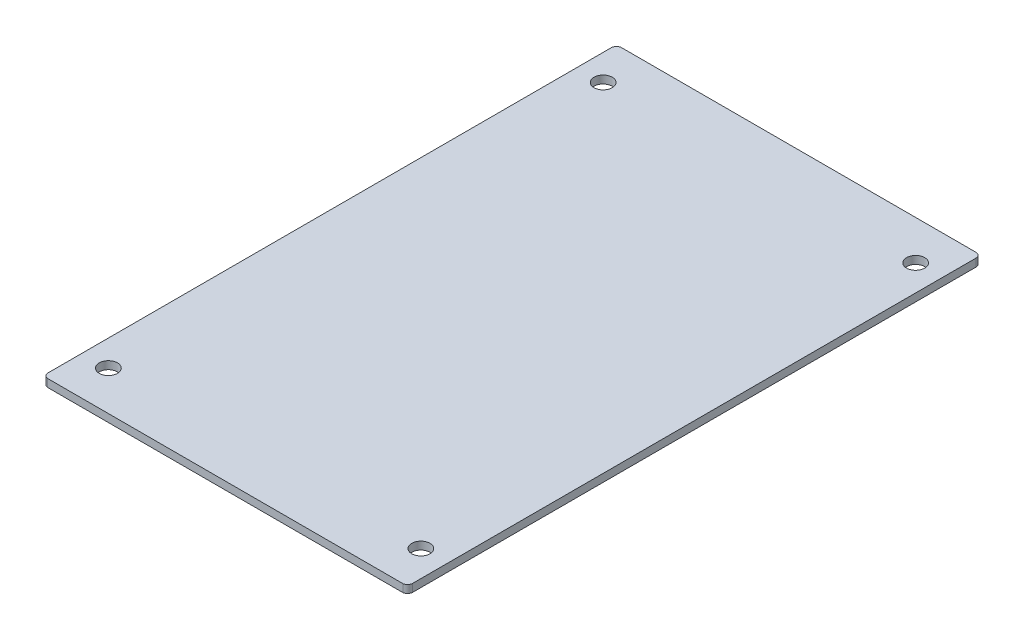
from build123d import *

# Parameters (mm, degrees)
SKETCH1_R           = 1.75
BOSS_EXTRUDE1_DEPTH = 1.5
FILLET1_R           = 7
FILLET2_R           = 1
FILLET3_R           = 50
SKETCH2_W           = 103.402572328
SKETCH2_H           = 105.78008475
CUT_EXTRUDE1_DEPTH  = 10


with BuildPart() as part:
    # Sketch1 → Boss-Extrude1 (new body)
    with BuildSketch(Plane(origin=(0, 0, 0), x_dir=(1, 0, 0), z_dir=(0, 1, 0))):
        Polygon((-35, -55), (-28, -55), (-28, -132), (0, -144), (28, -132), (28, -55), (35, -55), (35, 55), (28, 55), (28, 132), (0, 144), (-28, 132), (-28, 55), (-35, 55), align=None)
        with Locations(Location((-30, 47.5, 0), (0, 0, 270))):
            Circle(SKETCH1_R, mode=Mode.SUBTRACT)
        with Locations(Location((30, 47.5, 0), (0, 0, 270))):
            Circle(SKETCH1_R, mode=Mode.SUBTRACT)
        with Locations(Location((30, -47.5, 0), (0, 0, 270))):
            Circle(SKETCH1_R, mode=Mode.SUBTRACT)
        with Locations(Location((-30, -47.5, 0), (0, 0, 270))):
            Circle(SKETCH1_R, mode=Mode.SUBTRACT)
    extrude(amount=BOSS_EXTRUDE1_DEPTH)

    # Fillet1
    fillet1_edges = [part.edges().sort_by_distance(p)[0] for p in [
        (-28, 0.75, 55),
        (28, 0.75, 55),
        (28, 0.75, -55),
        (-28, 0.75, -55),
    ]]
    fillet(fillet1_edges, radius=FILLET1_R - 0.0001)  # a hair under: the kernel refuses the full size

    # Fillet2
    fillet2_edges = [part.edges().sort_by_distance(p)[0] for p in [
        (35, 0.75, -55),
        (35, 0.75, 55),
        (-35, 0.75, 55),
        (-35, 0.75, -55),
    ]]
    fillet(fillet2_edges, radius=FILLET2_R)

    # Fillet3
    fillet3_edges = [part.edges().sort_by_distance(p)[0] for p in [
        (0, 0.75, 144),
        (0, 0.75, -144),
    ]]
    fillet(fillet3_edges, radius=FILLET3_R)

    # Sketch2 → Cut-Extrude1 (cut)
    with BuildSketch(Plane(origin=(0, 1.5, 0), x_dir=(1, 0, 0), z_dir=(0, 1, 0))):
        with Locations((-17.576286164, 107.944945183)):
            Rectangle(SKETCH2_W, SKETCH2_H)
    cut_extrude1 = extrude(amount=-CUT_EXTRUDE1_DEPTH, mode=Mode.SUBTRACT)

    # Mirror1: Cut-Extrude1 across plane
    add(cut_extrude1.mirror(Plane.XY), mode=Mode.SUBTRACT)


solid = part.part
